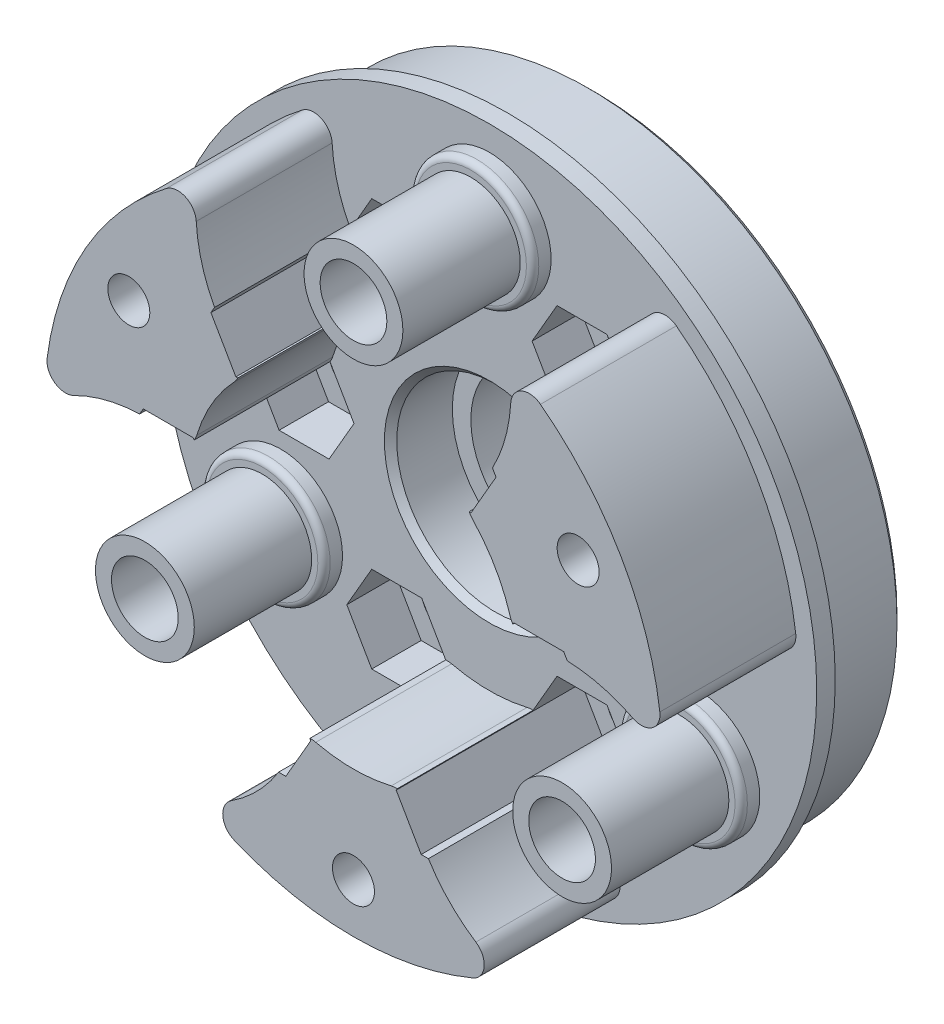
from build123d import *

# Parameters (mm, degrees)
SKETCH1_R                      = 25
SKETCH1_R_2                    = 2.7
SKETCH1_R_3                    = 2.700000000000001
BOSS_EXTRUDE1_DEPTH            = 8.5
SKETCH2_R                      = 4.0000000000000036
SKETCH2_R_2                    = 2.7
BOSS_EXTRUDE2_DEPTH            = 11
SKETCH3_R                      = 5.0000000000000036
SKETCH3_R_2                    = 4.0000000000000036
BOSS_EXTRUDE3_DEPTH            = 1.5
BOSS_EXTRUDE4_DEPTH            = 11
FILLET2_R                      = 0.5
FILLET5_R                      = 1.5
CIRPATTERN1_START              = 8.5
CIRPATTERN1_DEPTH              = 11
SKETCH5_R                      = 1.6999999999999988
CUT_EXTRUDE1_DEPTH             = 41.37635463857529
SKETCH6_R                      = 2.9500000000000006
CUT_EXTRUDE2_DEPTH             = 3
SKETCH7_R                      = 4.45
CUT_EXTRUDE3_DEPTH             = 5
CIRPATTERN2_COUNT              = 3
CHAMFER1_SIZE                  = 0.5
SKETCH9_R                      = 8
CUT_EXTRUDE4_DEPTH             = 38.02701732789181
BOSS_EXTRUDE7_START            = -3.5
SKETCH10_R                     = 8
SKETCH10_R_2                   = 6.500000000000002
BOSS_EXTRUDE7_DEPTH            = 3.5
CHAMFER2_SIZE                  = 0.5
BOSS_EXTRUDE8_START            = -1.5
SKETCH11_R                     = 26.500000000000004
SKETCH11_R_2                   = 25
BOSS_EXTRUDE8_DEPTH            = 1.5
CUT_EXTRUDE7_REACH             = 44.246
SKETCH14_R                     = 1.9999999999999996
CUT_EXTRUDE8_DEPTH             = 4
CUT_EXTRUDE8_DIRECTION_2_REACH = 41.058
CIRPATTERN4_COUNT              = 6


# Read off the part's stored shape, not the designer's step: CirPattern1
with BuildPart() as part:
    # Sketch1 → Boss-Extrude1 (new body)
    with BuildSketch(Plane.XY):
        Circle(SKETCH1_R)
        with Locations((0, 19.5)):
            Circle(SKETCH1_R_2, mode=Mode.SUBTRACT)
        with Locations((16.88749537379534, -9.750000000002105)):
            Circle(SKETCH1_R_3, mode=Mode.SUBTRACT)
        with Locations((-16.88749537379899, -9.750000000000009)):
            Circle(SKETCH1_R_3, mode=Mode.SUBTRACT)
    extrude(amount=BOSS_EXTRUDE1_DEPTH)

    # Sketch2 → Boss-Extrude2 (add)
    with BuildSketch(Plane.XY.offset(8.5)):
        with Locations((0, 19.5)):
            Circle(SKETCH2_R)
        with Locations((0, 19.5)):
            Circle(SKETCH2_R_2, mode=Mode.SUBTRACT)
    extrude(amount=BOSS_EXTRUDE2_DEPTH)

    # Sketch3 → Boss-Extrude3 (add)
    with BuildSketch(Plane.XY.offset(8.5)):
        with Locations((0, 19.5)):
            Circle(SKETCH3_R)
        with Locations((0, 19.5)):
            Circle(SKETCH3_R_2, mode=Mode.SUBTRACT)
    extrude(amount=BOSS_EXTRUDE3_DEPTH)

    # Sketch4 → Boss-Extrude4 (add)
    with BuildSketch(Plane.XY.offset(8.5)):
        with BuildLine():
            ThreePointArc((-8.595864638818421, 10.083333333333332), (-12.051904233708413, 15.338977969113694), (-12.57463654020182, 21.6073717948718))
            ThreePointArc((-12.57463654020182, 21.607371794871796), (-21.650635094611, 12.499999999999941), (-24.999851153475248, 0.08626878973480237))
            ThreePointArc((-24.999851153475245, 0.08626878973480423), (-19.309896706196515, 2.7677662458117602), (-13.030355140902314, 2.402570478042364))
            ThreePointArc((-13.030355140902312, 2.402570478042366), (-11.474836600143831, 6.62499999999997), (-8.595864638818423, 10.08333333333333))
        make_face()
    extrude(amount=BOSS_EXTRUDE4_DEPTH)

    # Fillet2
    fillet2_edges = [part.edges().sort_by_distance(p)[0] for p in [
        (-5.0000000000000036, 19.5, 10),
    ]]
    fillet(fillet2_edges, radius=FILLET2_R)

    # Fillet5
    fillet5_edges = [part.edges().sort_by_distance(p)[0] for p in [
        (-12.57463654020182, 21.607371794871796, 14),
        (-24.999851153475248, 0.08626878973480534, 14),
        (-13.030355140902312, 2.4025704780423656, 14),
        (-8.59586463881842, 10.083333333333332, 14),
    ]]
    fillet(fillet5_edges, radius=FILLET5_R)

    # CirPattern1 outline → CirPattern1 (add)
    with BuildSketch(Plane.XY.offset(CIRPATTERN1_START)):
        with BuildLine():
            ThreePointArc((-3.055336686, -12.892921226), (-4.126430807, -13.039456894), (-4.820831386, -13.868023823))
            ThreePointArc((-4.820831386, -13.868023823), (-6.81569801, -17.568017515), (-9.905301006, -20.418245489))
            ThreePointArc((-9.905301006, -20.418245489), (-10.577616507, -21.810119667), (-9.663687632, -23.056737439))
            ThreePointArc((-9.663687632, -23.056737439), (0, -25), (9.663687632, -23.056737439))
            ThreePointArc((9.663687632, -23.056737439), (10.577616507, -21.810119667), (9.905301006, -20.418245489))
            ThreePointArc((9.905301006, -20.418245489), (6.81569801, -17.568017515), (4.820831386, -13.868023823))
            ThreePointArc((4.820831386, -13.868023823), (4.126430807, -13.039456894), (3.055336686, -12.892921226))
            ThreePointArc((3.055336686, -12.892921226), (0, -13.25), (-3.055336686, -12.892921226))
        make_face()
        with BuildLine():
            ThreePointArc((24.799564167, 3.159369736), (21.650635095, 12.5), (15.135876535, 19.897367703))
            ThreePointArc((15.135876535, 19.897367703), (13.599309437, 20.06554444), (12.730068791, 18.787365047))
            ThreePointArc((12.730068791, 18.787365047), (11.806500457, 14.686576379), (9.599645238, 11.108974359))
            ThreePointArc((9.599645238, 11.108974359), (9.229285518, 10.093322353), (9.637928968, 9.0924598))
            ThreePointArc((9.637928968, 9.0924598), (11.4748366, 6.625), (12.693265654, 3.800461426))
            ThreePointArc((12.693265654, 3.800461426), (13.355716326, 2.946134541), (14.420476624, 2.759049464))
            ThreePointArc((14.420476624, 2.759049464), (18.622198468, 2.881441136), (22.635369797, 1.630880441))
            ThreePointArc((22.635369797, 1.630880441), (24.176925945, 1.744575226), (24.799564167, 3.159369736))
        make_face()
    extrude(amount=CIRPATTERN1_DEPTH)

    # CirPattern1 2 outline → CirPattern1 2 (revolve)
    with BuildSketch(Plane(origin=(-16.887495374, -9.75, 0), x_dir=(1, 0, 0), z_dir=(0, -1, 0))):
        with BuildLine():
            Line((4, 19.5), (2.7, 19.5))
            Line((2.7, 19.5), (2.7, 8.5))
            Line((2.7, 8.5), (5, 8.5))
            Line((5, 8.5), (5, 9.5))
            ThreePointArc((5, 9.5), (4.853553391, 9.853553391), (4.5, 10))
            Line((4.5, 10), (4, 10))
            Line((4, 10), (4, 19.5))
        make_face()
    revolve(axis=Axis((-16.887495374, -9.75, 0), (0, 0, 1)))

    # CirPattern1 3 outline → CirPattern1 3 (revolve)
    with BuildSketch(Plane(origin=(16.887495374, -9.75, 0), x_dir=(1, 0, 0), z_dir=(0, -1, 0))):
        with BuildLine():
            Line((4, 19.5), (2.7, 19.5))
            Line((2.7, 19.5), (2.7, 8.5))
            Line((2.7, 8.5), (5, 8.5))
            Line((5, 8.5), (5, 9.5))
            ThreePointArc((5, 9.5), (4.853553391, 9.853553391), (4.5, 10))
            Line((4.5, 10), (4, 10))
            Line((4, 10), (4, 19.5))
        make_face()
    revolve(axis=Axis((16.887495374, -9.75, 0), (0, 0, 1)))

    # Sketch5 → Cut-Extrude1 (cut, through all)
    with BuildSketch(Plane.XY.offset(19.5)):
        with Locations((-18.186533479473244, 10.499999999999957)):
            Circle(SKETCH5_R)
    cut_extrude1 = extrude(amount=-CUT_EXTRUDE1_DEPTH, mode=Mode.SUBTRACT)

    # Sketch6 → Cut-Extrude2 (cut)
    with BuildSketch(Plane(origin=(0, 0, 0), x_dir=(-1, 0, 0), z_dir=(0, 0, -1))):
        with Locations((18.186533479473244, 10.499999999999956)):
            Circle(SKETCH6_R)
    cut_extrude2 = extrude(amount=-CUT_EXTRUDE2_DEPTH, mode=Mode.SUBTRACT)

    # Sketch7 → Cut-Extrude3 (cut)
    with BuildSketch(Plane(origin=(0, 0, 0), x_dir=(-1, 0, 0), z_dir=(0, 0, -1))):
        with Locations((0, 19.5)):
            Circle(SKETCH7_R)
    cut_extrude3 = extrude(amount=-CUT_EXTRUDE3_DEPTH, mode=Mode.SUBTRACT)

    # CirPattern2: Cut-Extrude1, Cut-Extrude2, Cut-Extrude3 ×3 about axis
    cirpattern2_axis = Axis((4.8e-16, -1.84e-15, 0), (0, 0, 1))
    add([cut_extrude1.rotate(cirpattern2_axis, i * 360 / CIRPATTERN2_COUNT) for i in range(1, CIRPATTERN2_COUNT)], mode=Mode.SUBTRACT)
    add([cut_extrude2.rotate(cirpattern2_axis, i * 360 / CIRPATTERN2_COUNT) for i in range(1, CIRPATTERN2_COUNT)], mode=Mode.SUBTRACT)
    add([cut_extrude3.rotate(cirpattern2_axis, i * 360 / CIRPATTERN2_COUNT) for i in range(1, CIRPATTERN2_COUNT)], mode=Mode.SUBTRACT)

    # Chamfer1
    chamfer1_edges = [part.edges().sort_by_distance(p)[0] for p in [
        (-25, 3.06e-15, 0),
    ]]
    chamfer(chamfer1_edges, length=CHAMFER1_SIZE)

    # Sketch9 → Cut-Extrude4 (cut, through all)
    with BuildSketch(Plane.XY.offset(8.5)):
        Circle(SKETCH9_R)
    extrude(amount=-CUT_EXTRUDE4_DEPTH, mode=Mode.SUBTRACT)

    # Sketch10 → Boss-Extrude7 (add)
    with BuildSketch(Plane(origin=(0, 0, 0), x_dir=(-1, 0, 0), z_dir=(0, 0, -1)).offset(BOSS_EXTRUDE7_START)):
        with Locations(Location((0, 0, 0), (0, 0, 180))):
            Circle(SKETCH10_R)
        Circle(SKETCH10_R_2, mode=Mode.SUBTRACT)
    extrude(amount=BOSS_EXTRUDE7_DEPTH)

    # Chamfer2
    chamfer2_edges = [part.edges().sort_by_distance(p)[0] for p in [
        (-8, 9.8e-16, 8.5),
    ]]
    chamfer(chamfer2_edges, length=CHAMFER2_SIZE)

    # Sketch11 → Boss-Extrude8 (add)
    with BuildSketch(Plane.XY.offset(8.5).offset(BOSS_EXTRUDE8_START)):
        Circle(SKETCH11_R)
        Circle(SKETCH11_R_2, mode=Mode.SUBTRACT)
    extrude(amount=BOSS_EXTRUDE8_DEPTH)

    # Sketch14 → Cut-Extrude7 (cut, up to next)
    with BuildSketch(Plane(origin=(0, 0, 0), x_dir=(-1, 0, 0), z_dir=(0, 0, -1)), mode=Mode.PRIVATE) as cut_extrude7_sk1:
        with Locations((-7.499999999999925, 12.990381056766624)):
            Circle(SKETCH14_R)
    cut_extrude7_tool1 = extrude(cut_extrude7_sk1.sketch, amount=-CUT_EXTRUDE7_REACH, mode=Mode.PRIVATE) & part.part
    cut_extrude7 = cut_extrude7_tool1.solids().sort_by_distance((7.5, 12.990381, 0))[0]
    add(cut_extrude7, mode=Mode.SUBTRACT)

    # Sketch15 → Cut-Extrude8 (cut)
    with BuildSketch(Plane.XY.offset(8.5)):
        Polygon((9.520725942163613, 9.49038105676663), (11.5414518843273, 12.990381056766624), (9.520725942163615, 16.49038105676662), (5.4792740578362364, 16.49038105676662), (3.4585481156725493, 12.990381056766624), (5.479274057836236, 9.490381056766628), align=None)
    cut_extrude8 = extrude(amount=-CUT_EXTRUDE8_DEPTH, mode=Mode.SUBTRACT)

    # Sketch15 → Cut-Extrude8 direction 2 (cut, up to next)
    with BuildSketch(Plane.XY.offset(8.5), mode=Mode.PRIVATE) as cut_extrude8_direction_2_sk1:
        Polygon((9.520725942163613, 9.49038105676663), (11.5414518843273, 12.990381056766624), (9.520725942163615, 16.49038105676662), (5.4792740578362364, 16.49038105676662), (3.4585481156725493, 12.990381056766624), (5.479274057836236, 9.490381056766628), align=None)
    cut_extrude8_direction_2_tool1 = extrude(cut_extrude8_direction_2_sk1.sketch, amount=CUT_EXTRUDE8_DIRECTION_2_REACH, mode=Mode.PRIVATE) & part.part
    cut_extrude8_direction_2 = cut_extrude8_direction_2_tool1.solids().sort_by_distance((7.5, 12.990381, 8.5))[0]
    add(cut_extrude8_direction_2, mode=Mode.SUBTRACT)

    # CirPattern4: Cut-Extrude7, Cut-Extrude8, Cut-Extrude8 direction 2; each copy of Cut-Extrude7, Cut-Extrude8 direction 2 runs up to whatever stops it at its own place
    cirpattern4_before = part.part  # the part as the pattern finds it: every copy runs up to it
    cirpattern4_cut_extrude7_long = extrude(cut_extrude7_sk1.sketch, amount=-CUT_EXTRUDE7_REACH, mode=Mode.PRIVATE)
    cirpattern4_cut_extrude7_tool1 = cirpattern4_cut_extrude7_long.rotate(Axis((-3.9e-15, 2.33e-15, 0), (0, 0, 1)), 1 * 360 / CIRPATTERN4_COUNT) & cirpattern4_before
    add(cirpattern4_cut_extrude7_tool1.solids().sort_by_distance((-7.5, 12.990381, 0))[0], mode=Mode.SUBTRACT)
    cirpattern4_cut_extrude7_tool2 = cirpattern4_cut_extrude7_long.rotate(Axis((-3.9e-15, 2.33e-15, 0), (0, 0, 1)), 2 * 360 / CIRPATTERN4_COUNT) & cirpattern4_before
    add(cirpattern4_cut_extrude7_tool2.solids().sort_by_distance((-15, 0, 0))[0], mode=Mode.SUBTRACT)
    cirpattern4_cut_extrude7_tool3 = cirpattern4_cut_extrude7_long.rotate(Axis((-3.9e-15, 2.33e-15, 0), (0, 0, 1)), 3 * 360 / CIRPATTERN4_COUNT) & cirpattern4_before
    add(cirpattern4_cut_extrude7_tool3.solids().sort_by_distance((-7.5, -12.990381, 0))[0], mode=Mode.SUBTRACT)
    cirpattern4_cut_extrude7_tool4 = cirpattern4_cut_extrude7_long.rotate(Axis((-3.9e-15, 2.33e-15, 0), (0, 0, 1)), 4 * 360 / CIRPATTERN4_COUNT) & cirpattern4_before
    add(cirpattern4_cut_extrude7_tool4.solids().sort_by_distance((7.5, -12.990381, 0))[0], mode=Mode.SUBTRACT)
    cirpattern4_cut_extrude7_tool5 = cirpattern4_cut_extrude7_long.rotate(Axis((-3.9e-15, 2.33e-15, 0), (0, 0, 1)), 5 * 360 / CIRPATTERN4_COUNT) & cirpattern4_before
    add(cirpattern4_cut_extrude7_tool5.solids().sort_by_distance((15, 0, 0))[0], mode=Mode.SUBTRACT)
    add(cut_extrude8.rotate(Axis((-3.9e-15, 2.33e-15, 0), (0, 0, 1)), 1 * 360 / CIRPATTERN4_COUNT), mode=Mode.SUBTRACT)
    add(cut_extrude8.rotate(Axis((-3.9e-15, 2.33e-15, 0), (0, 0, 1)), 2 * 360 / CIRPATTERN4_COUNT), mode=Mode.SUBTRACT)
    add(cut_extrude8.rotate(Axis((-3.9e-15, 2.33e-15, 0), (0, 0, 1)), 3 * 360 / CIRPATTERN4_COUNT), mode=Mode.SUBTRACT)
    add(cut_extrude8.rotate(Axis((-3.9e-15, 2.33e-15, 0), (0, 0, 1)), 4 * 360 / CIRPATTERN4_COUNT), mode=Mode.SUBTRACT)
    add(cut_extrude8.rotate(Axis((-3.9e-15, 2.33e-15, 0), (0, 0, 1)), 5 * 360 / CIRPATTERN4_COUNT), mode=Mode.SUBTRACT)
    cirpattern4_cut_extrude8_direction_2_long = extrude(cut_extrude8_direction_2_sk1.sketch, amount=CUT_EXTRUDE8_DIRECTION_2_REACH, mode=Mode.PRIVATE)
    cirpattern4_cut_extrude8_direction_2_tool1 = cirpattern4_cut_extrude8_direction_2_long.rotate(Axis((-3.9e-15, 2.33e-15, 0), (0, 0, 1)), 1 * 360 / CIRPATTERN4_COUNT) & cirpattern4_before
    add(cirpattern4_cut_extrude8_direction_2_tool1.solids().sort_by_distance((-7.5, 12.990381, 8.5))[0], mode=Mode.SUBTRACT)
    cirpattern4_cut_extrude8_direction_2_tool2 = cirpattern4_cut_extrude8_direction_2_long.rotate(Axis((-3.9e-15, 2.33e-15, 0), (0, 0, 1)), 2 * 360 / CIRPATTERN4_COUNT) & cirpattern4_before
    add(cirpattern4_cut_extrude8_direction_2_tool2.solids().sort_by_distance((-15, 0, 8.5))[0], mode=Mode.SUBTRACT)
    cirpattern4_cut_extrude8_direction_2_tool3 = cirpattern4_cut_extrude8_direction_2_long.rotate(Axis((-3.9e-15, 2.33e-15, 0), (0, 0, 1)), 3 * 360 / CIRPATTERN4_COUNT) & cirpattern4_before
    add(cirpattern4_cut_extrude8_direction_2_tool3.solids().sort_by_distance((-7.5, -12.990381, 8.5))[0], mode=Mode.SUBTRACT)
    cirpattern4_cut_extrude8_direction_2_tool4 = cirpattern4_cut_extrude8_direction_2_long.rotate(Axis((-3.9e-15, 2.33e-15, 0), (0, 0, 1)), 4 * 360 / CIRPATTERN4_COUNT) & cirpattern4_before
    add(cirpattern4_cut_extrude8_direction_2_tool4.solids().sort_by_distance((7.5, -12.990381, 8.5))[0], mode=Mode.SUBTRACT)
    cirpattern4_cut_extrude8_direction_2_tool5 = cirpattern4_cut_extrude8_direction_2_long.rotate(Axis((-3.9e-15, 2.33e-15, 0), (0, 0, 1)), 5 * 360 / CIRPATTERN4_COUNT) & cirpattern4_before
    add(cirpattern4_cut_extrude8_direction_2_tool5.solids().sort_by_distance((15, 0, 8.5))[0], mode=Mode.SUBTRACT)


solid = part.part
